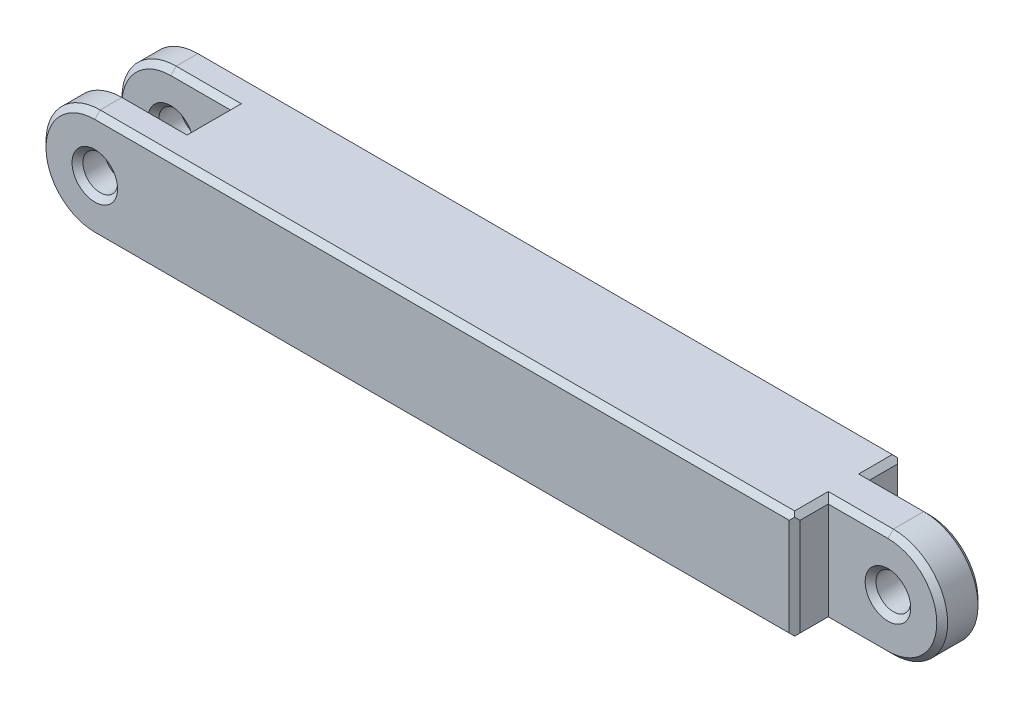
from build123d import *

# Parameters (mm, degrees)
SKETCH1_R           = 1.6
BOSS_EXTRUDE1_DEPTH = 10
CUT_EXTRUDE1_START  = -7
CUT_EXTRUDE1_DEPTH  = 4
CHAMFER1_SIZE       = 0.5
CUT_EXTRUDE2_START  = -3.1
CUT_EXTRUDE2_DEPTH  = 3.1
CUT_EXTRUDE3_START  = -6.9
CUT_EXTRUDE3_DEPTH  = 3.1
CHAMFER2_SIZE       = 0.5


with BuildPart() as part:
    # Sketch1 → Boss-Extrude1 (new body)
    with BuildSketch(Plane.XY):
        with BuildLine():
            Line((0, 5), (70, 5))
            ThreePointArc((70, 5), (75, 0), (70, -5))
            Line((70, -5), (0, -5))
            ThreePointArc((0, -5), (-5, 0), (0, 5))
        make_face()
        Circle(SKETCH1_R, mode=Mode.SUBTRACT)
        with Locations((70, 0)):
            Circle(SKETCH1_R, mode=Mode.SUBTRACT)
    extrude(amount=BOSS_EXTRUDE1_DEPTH)

    # Sketch2 → Cut-Extrude1 (cut)
    with BuildSketch(Plane.XY.offset(10).offset(CUT_EXTRUDE1_START)):
        with BuildLine():
            Line((5.5, 5), (5.5, -5))
            Line((5.5, -5), (0, -5))
            ThreePointArc((0, -5), (-5, 0), (0, 5))
            Line((0, 5), (5.5, 5))
        make_face()
    extrude(amount=CUT_EXTRUDE1_DEPTH, mode=Mode.SUBTRACT)

    # Chamfer1
    chamfer1_edges = [part.edges().sort_by_distance(p)[0] for p in [
        (75, 0, 10),
        (-1.6, 0, 0),
        (-1.6, 0, 10),
        (35, 5, 10),
        (68.4, 0, 0),
        (68.4, 0, 10),
        (-1.6, 0, 3),
        (2.75, 5, 3),
        (5.5, 5, 5),
        (2.75, -5, 3),
        (5.5, -5, 5),
        (-5, 0, 3),
        (-1.6, 0, 7),
        (2.75, 5, 7),
        (-5, 0, 7),
        (2.75, -5, 7),
        (-5, 0, 10),
        (35, 5, 0),
        (75, 0, 0),
        (35, -5, 0),
        (-5, 0, 0),
        (35, -5, 10),
    ]]
    chamfer(chamfer1_edges, length=CHAMFER1_SIZE)

    # Sketch3 → Cut-Extrude2 (cut)
    with BuildSketch(Plane.XY.offset(10).offset(CUT_EXTRUDE2_START)):
        with BuildLine():
            Line((64.5, 5), (64.5, -5))
            Line((64.5, -5), (70, -5))
            ThreePointArc((70, -5), (75, 0), (70, 5))
            Line((70, 5), (64.5, 5))
        make_face()
    extrude(amount=CUT_EXTRUDE2_DEPTH, mode=Mode.SUBTRACT)

    # Sketch4 → Cut-Extrude3 (cut)
    with BuildSketch(Plane.XY.offset(6.9).offset(CUT_EXTRUDE3_START)):
        with BuildLine():
            Line((64.5, 5), (64.5, -5))
            Line((64.5, -5), (70, -5))
            ThreePointArc((70, -5), (75, 0), (70, 5))
            Line((70, 5), (64.5, 5))
        make_face()
    extrude(amount=CUT_EXTRUDE3_DEPTH, mode=Mode.SUBTRACT)

    # Chamfer2
    # the kernel refuses this chamfer: 0.5 mm, written as the material it takes off along each edge
    with BuildSketch(Plane(origin=(70, 0, 6.9), x_dir=(1, 0, 0), z_dir=(0, 1, 0))) as chamfer2_piece_1:
        Polygon((1.6 + CHAMFER2_SIZE, 0), (1.6, CHAMFER2_SIZE), (1.6, 0), align=None)
    revolve(axis=Axis((70, 0, 6.9), (0, 0, -1)), mode=Mode.SUBTRACT)
    with BuildSketch(Plane(origin=(70, 0, 3.1), x_dir=(1, 0, 0), z_dir=(0, 1, 0))) as chamfer2_piece_2:
        Polygon((1.6 + CHAMFER2_SIZE, 0), (1.6, -CHAMFER2_SIZE), (1.6, 0), align=None)
    revolve(axis=Axis((70, 0, 3.1), (0, 0, -1)), mode=Mode.SUBTRACT)
    with BuildSketch(Plane(origin=(64.5, -5, -0.785841494), x_dir=(0.0274958766105822, 0.999621916911297, 0), z_dir=(0, 0, 1)), Plane(origin=(64.5, 5, -0.785841494), x_dir=(-0.9996219169112968, 0.02749587661058574, 0), z_dir=(0, 0, 1)), Plane(origin=(64.5, -5, 6.9), x_dir=(0.0274958766105822, 0.999621916911297, 0), z_dir=(0, 0, 1)), Plane(origin=(64.5, 5, 6.9), x_dir=(-0.9996219169112973, 0.027495876610566763, 0), z_dir=(0, 0, 1))) as chamfer2_piece_3:
        Polygon((CHAMFER2_SIZE * 0.999621916911, CHAMFER2_SIZE * 0.0274958766106), (-CHAMFER2_SIZE * 0.0274958766106, CHAMFER2_SIZE * 0.999621916911), (0, 0), align=None)
    extrude(amount=3.885841494, mode=Mode.SUBTRACT)
    with BuildSketch(Plane(origin=(64.5, 5.785841494, 0), x_dir=(0.027495876610582174, 0, 0.9996219169112968), z_dir=(0, -1, 0))) as chamfer2_piece_4:
        Polygon((CHAMFER2_SIZE * 0.999621916911, CHAMFER2_SIZE * 0.0274958766106), (-CHAMFER2_SIZE * 0.0274958766106, CHAMFER2_SIZE * 0.999621916911), (0, 0), align=None)
    extrude(amount=11.571682988, mode=Mode.SUBTRACT)
    with BuildSketch(Plane(origin=(64.5, -5, 3.1), x_dir=(0, 0.9996219169112968, -0.027495876610586462), z_dir=(1, 0, 0)), Plane(origin=(70, 5, 6.9), x_dir=(0, 0.027495876610585647, -0.9996219169112968), z_dir=(-1, 0, 0))) as chamfer2_piece_5:
        Polygon((CHAMFER2_SIZE * 0.999621916911, CHAMFER2_SIZE * 0.0274958766106), (-CHAMFER2_SIZE * 0.0274958766106, CHAMFER2_SIZE * 0.999621916911), (0, 0), align=None)
    extrude(amount=5.5, mode=Mode.SUBTRACT)
    with BuildSketch(Plane(origin=(70, 0, 3.1), x_dir=(0, -1, 0), z_dir=(-1, 0, 0))) as chamfer2_piece_6:
        Polygon((5, CHAMFER2_SIZE), (5 - CHAMFER2_SIZE, 0), (5, 0), align=None)
    revolve(axis=Axis((70, 0, 3.1), (0, 0, 1)), revolution_arc=180, mode=Mode.SUBTRACT)
    with BuildSketch(Plane(origin=(70, 5, 3.1), x_dir=(0, 0.027495876610585623, 0.9996219169112968), z_dir=(-1, 0, 0)), Plane(origin=(64.5, -5, 6.9), x_dir=(0, 0.9996219169112968, 0.0274958766105856), z_dir=(1, 0, 0))) as chamfer2_piece_7:
        Polygon((CHAMFER2_SIZE * 0.999621916911, -CHAMFER2_SIZE * 0.0274958766106), (-CHAMFER2_SIZE * 0.0274958766106, -CHAMFER2_SIZE * 0.999621916911), (0, 0), align=None)
    extrude(amount=5.5, mode=Mode.SUBTRACT)
    with BuildSketch(Plane(origin=(64.5, 5.785841494, 10), x_dir=(0.0274958766105822, 0, -0.999621916911297), z_dir=(0, -1, 0))) as chamfer2_piece_8:
        Polygon((CHAMFER2_SIZE * 0.999621916911, -CHAMFER2_SIZE * 0.0274958766106), (-CHAMFER2_SIZE * 0.0274958766106, -CHAMFER2_SIZE * 0.999621916911), (0, 0), align=None)
    extrude(amount=11.571682988, mode=Mode.SUBTRACT)
    with BuildSketch(Plane(origin=(70, 0, 6.9), x_dir=(0, -1, 0), z_dir=(-1, 0, 0))) as chamfer2_piece_9:
        Polygon((5, -CHAMFER2_SIZE), (5 - CHAMFER2_SIZE, 0), (5, 0), align=None)
    revolve(axis=Axis((70, 0, 6.9), (0, 0, 1)), revolution_arc=180, mode=Mode.SUBTRACT)
    with BuildSketch(Plane(origin=(64.5, -5, -0.785841494), x_dir=(0.0274958766105822, 0.999621916911297, 0), z_dir=(0, 0, 1))) as chamfer2_piece_10a_section:
        Polygon((CHAMFER2_SIZE * 0.999621916911, CHAMFER2_SIZE * 0.0274958766106), (-CHAMFER2_SIZE * 0.0274958766106, CHAMFER2_SIZE * 0.999621916911), (0, 0), align=None)
    chamfer2_piece_10a = extrude(amount=5.171682988, mode=Mode.PRIVATE)
    chamfer2_piece_10a = split(chamfer2_piece_10a, bisect_by=Plane(origin=(64.335103187, -4.835103187, 3.1), z_dir=(0, 0, 1)), keep=Keep.TOP, mode=Mode.PRIVATE)
    with BuildSketch(Plane(origin=(63.214158506, -5, 3.1), x_dir=(0, 0.9996219169112968, -0.02749587661058651), z_dir=(1, 0, 0))) as chamfer2_piece_10b_section:
        Polygon((CHAMFER2_SIZE * 0.999621916911, CHAMFER2_SIZE * 0.0274958766106), (-CHAMFER2_SIZE * 0.0274958766106, CHAMFER2_SIZE * 0.999621916911), (0, 0), align=None)
    chamfer2_piece_10b = extrude(amount=6.785841494, mode=Mode.PRIVATE)
    chamfer2_piece_10b = split(chamfer2_piece_10b, bisect_by=Plane(origin=(64.5, -4.835103187, 3.264896813), z_dir=(-1, 0, 0)), keep=Keep.TOP, mode=Mode.PRIVATE)
    chamfer2_piece_10 = chamfer2_piece_10a & chamfer2_piece_10b
    add(chamfer2_piece_10, mode=Mode.SUBTRACT)
    with BuildSketch(Plane(origin=(64.5, 5, -0.785841494), x_dir=(-0.9996219169112968, 0.02749587661058574, 0), z_dir=(0, 0, 1))) as chamfer2_piece_11a_section:
        Polygon((CHAMFER2_SIZE * 0.999621916911, CHAMFER2_SIZE * 0.0274958766106), (-CHAMFER2_SIZE * 0.0274958766106, CHAMFER2_SIZE * 0.999621916911), (0, 0), align=None)
    chamfer2_piece_11a = extrude(amount=5.171682988, mode=Mode.PRIVATE)
    chamfer2_piece_11a = split(chamfer2_piece_11a, bisect_by=Plane(origin=(64.335103187, 4.835103187, 3.1), z_dir=(0, 0, 1)), keep=Keep.TOP, mode=Mode.PRIVATE)
    with BuildSketch(Plane(origin=(70, 5, 3.1), x_dir=(0, 0.027495876610585623, 0.9996219169112968), z_dir=(-1, 0, 0))) as chamfer2_piece_11b_section:
        Polygon((CHAMFER2_SIZE * 0.999621916911, -CHAMFER2_SIZE * 0.0274958766106), (-CHAMFER2_SIZE * 0.0274958766106, -CHAMFER2_SIZE * 0.999621916911), (0, 0), align=None)
    chamfer2_piece_11b = extrude(amount=6.785841494, mode=Mode.PRIVATE)
    chamfer2_piece_11b = split(chamfer2_piece_11b, bisect_by=Plane(origin=(64.5, 4.835103187, 3.264896813), z_dir=(-1, 0, 0)), keep=Keep.TOP, mode=Mode.PRIVATE)
    chamfer2_piece_11 = chamfer2_piece_11a & chamfer2_piece_11b
    add(chamfer2_piece_11, mode=Mode.SUBTRACT)
    with BuildSketch(Plane(origin=(63.214158506, -5, 6.9), x_dir=(0, 0.9996219169112968, 0.027495876610585647), z_dir=(1, 0, 0))) as chamfer2_piece_12a_section:
        Polygon((CHAMFER2_SIZE * 0.999621916911, -CHAMFER2_SIZE * 0.0274958766106), (-CHAMFER2_SIZE * 0.0274958766106, -CHAMFER2_SIZE * 0.999621916911), (0, 0), align=None)
    chamfer2_piece_12a = extrude(amount=6.785841494, mode=Mode.PRIVATE)
    chamfer2_piece_12a = split(chamfer2_piece_12a, bisect_by=Plane(origin=(64.5, -4.835103187, 6.735103187), z_dir=(-1, 0, 0)), keep=Keep.TOP, mode=Mode.PRIVATE)
    with BuildSketch(Plane(origin=(64.5, -5, 5.614158506), x_dir=(0.0274958766105822, 0.999621916911297, 0), z_dir=(0, 0, 1))) as chamfer2_piece_12b_section:
        Polygon((CHAMFER2_SIZE * 0.999621916911, CHAMFER2_SIZE * 0.0274958766106), (-CHAMFER2_SIZE * 0.0274958766106, CHAMFER2_SIZE * 0.999621916911), (0, 0), align=None)
    chamfer2_piece_12b = extrude(amount=5.171682988, mode=Mode.PRIVATE)
    chamfer2_piece_12b = split(chamfer2_piece_12b, bisect_by=Plane(origin=(64.335103187, -4.835103187, 6.9), z_dir=(0, 0, -1)), keep=Keep.TOP, mode=Mode.PRIVATE)
    chamfer2_piece_12 = chamfer2_piece_12a & chamfer2_piece_12b
    add(chamfer2_piece_12, mode=Mode.SUBTRACT)
    with BuildSketch(Plane(origin=(70, 5, 6.9), x_dir=(0, 0.027495876610585647, -0.9996219169112968), z_dir=(-1, 0, 0))) as chamfer2_piece_13a_section:
        Polygon((CHAMFER2_SIZE * 0.999621916911, CHAMFER2_SIZE * 0.0274958766106), (-CHAMFER2_SIZE * 0.0274958766106, CHAMFER2_SIZE * 0.999621916911), (0, 0), align=None)
    chamfer2_piece_13a = extrude(amount=6.785841494, mode=Mode.PRIVATE)
    chamfer2_piece_13a = split(chamfer2_piece_13a, bisect_by=Plane(origin=(64.5, 4.835103187, 6.735103187), z_dir=(-1, 0, 0)), keep=Keep.TOP, mode=Mode.PRIVATE)
    with BuildSketch(Plane(origin=(64.5, 5, 5.614158506), x_dir=(-0.9996219169112968, 0.02749587661058574, 0), z_dir=(0, 0, 1))) as chamfer2_piece_13b_section:
        Polygon((CHAMFER2_SIZE * 0.999621916911, CHAMFER2_SIZE * 0.0274958766106), (-CHAMFER2_SIZE * 0.0274958766106, CHAMFER2_SIZE * 0.999621916911), (0, 0), align=None)
    chamfer2_piece_13b = extrude(amount=5.171682988, mode=Mode.PRIVATE)
    chamfer2_piece_13b = split(chamfer2_piece_13b, bisect_by=Plane(origin=(64.335103187, 4.835103187, 6.9), z_dir=(0, 0, -1)), keep=Keep.TOP, mode=Mode.PRIVATE)
    chamfer2_piece_13 = chamfer2_piece_13a & chamfer2_piece_13b
    add(chamfer2_piece_13, mode=Mode.SUBTRACT)


solid = part.part
